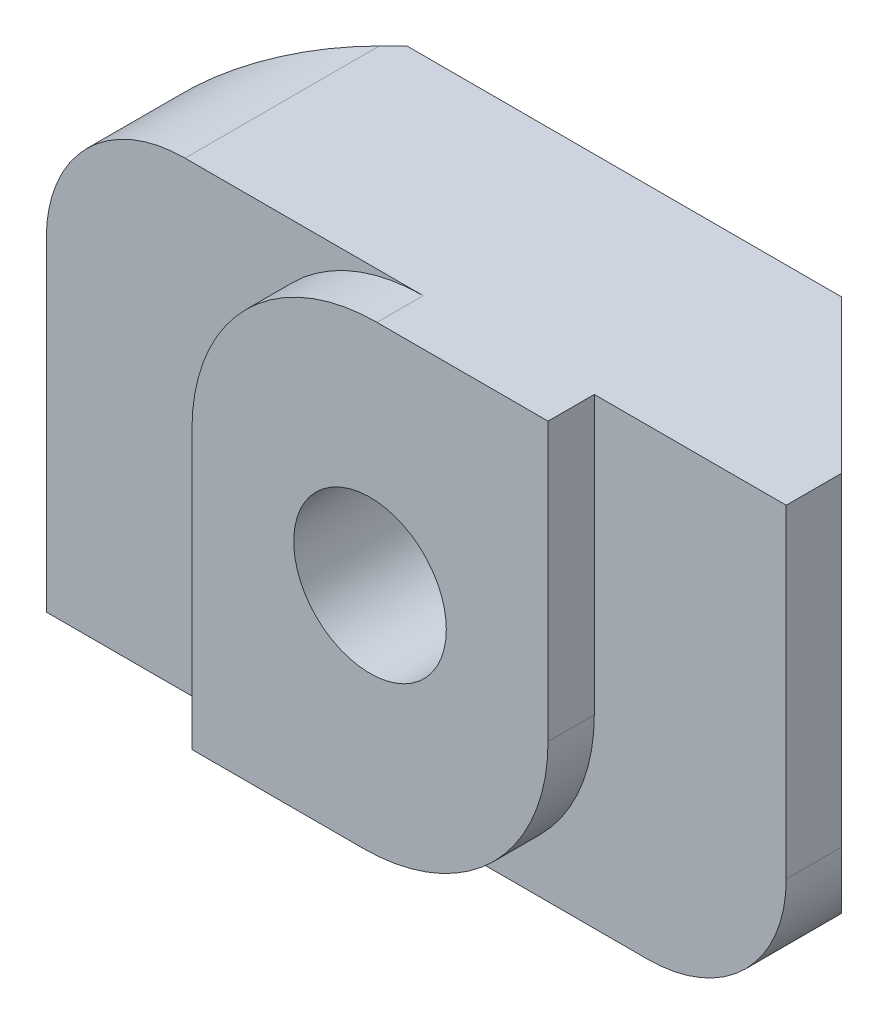
from build123d import *

# Parameters (mm, degrees)
BOSS_EXTRUDE1_DEPTH = 10
SKETCH2_R           = 1.65
CUT_EXTRUDE1_DEPTH  = 14.937359865
FILLET1_R           = 4
FILLET2_R           = 3


with BuildPart() as part:
    # Sketch1 → Boss-Extrude1 (new body)
    with BuildSketch(Plane(origin=(0, 0, 0), x_dir=(1, 0, 0), z_dir=(0, 1, 0))):
        Polygon((4.7, 0), (-4.7, 0), (-8, -3.3), (-8, -4.5), (-3.85, -4.5), (-3.85, -5.5), (3.85, -5.5), (3.85, -4.5), (8, -4.5), (8, -3.3), align=None)
    extrude(amount=BOSS_EXTRUDE1_DEPTH)

    # Sketch2 → Cut-Extrude1 (cut, through all)
    with BuildSketch(Plane.XY.offset(5.5)):
        with Locations((0, 5)):
            Circle(SKETCH2_R)
    extrude(amount=-CUT_EXTRUDE1_DEPTH, mode=Mode.SUBTRACT)

    # Fillet1
    fillet1_edges = [part.edges().sort_by_distance(p)[0] for p in [
        (-3.85, 10, 5),
        (3.85, 0, 5),
    ]]
    fillet(fillet1_edges, radius=FILLET1_R)

    # Fillet2
    fillet2_edges = [part.edges().sort_by_distance(p)[0] for p in [
        (-8, 10, 3.9),
        (8, 0, 3.9),
    ]]
    fillet(fillet2_edges, radius=FILLET2_R)


solid = part.part
